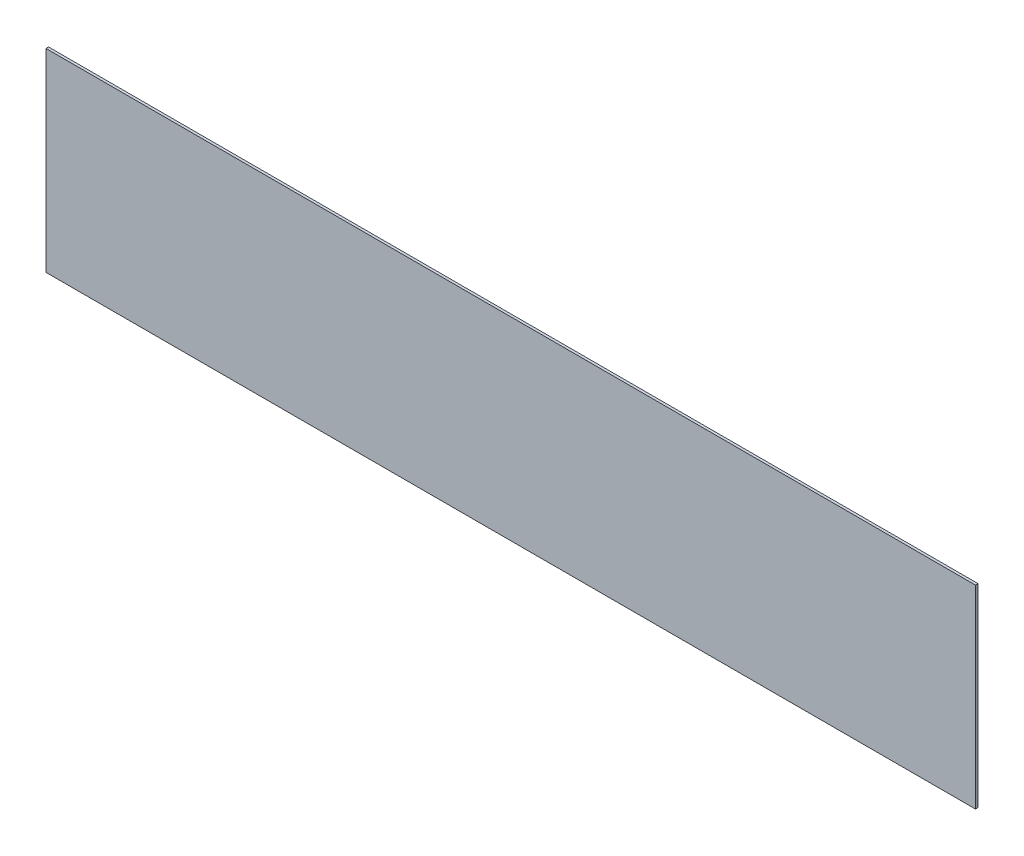
from build123d import *

# Parameters (mm, degrees)
SKETCH1_W           = 575
SKETCH1_H           = 120
BOSS_EXTRUDE1_DEPTH = 1.5875


with BuildPart() as part:
    # Sketch1 → Boss-Extrude1 (new body)
    with BuildSketch(Plane.XY):
        Rectangle(SKETCH1_W, SKETCH1_H)
    extrude(amount=BOSS_EXTRUDE1_DEPTH)


solid = part.part
